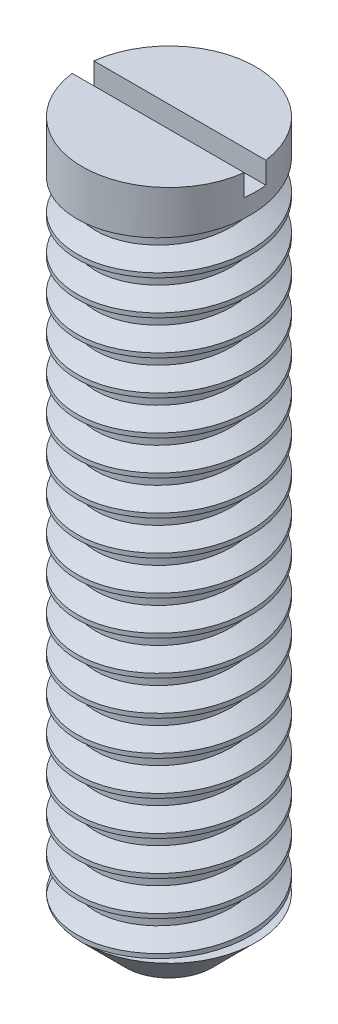
from build123d import *

# Parameters (mm, degrees)
SKETCH1_R           = 2
BOSS_EXTRUDE1_DEPTH = 15
THREAD1_PITCH       = 0.8
BOSS_EXTRUDE2_DEPTH = 0.5
SKETCH5_R           = 2
BOSS_EXTRUDE3_DEPTH = 1
BOSS_EXTRUDE3_TAPER = 45


with BuildPart() as part:
    # Sketch1 → Boss-Extrude1 (new body)
    with BuildSketch(Plane(origin=(0, 0, 0), x_dir=(1, 0, 0), z_dir=(0, 1, 0))):
        with Locations(Location((0, 0, 0), (0, 0, 270))):
            Circle(SKETCH1_R)
    extrude(amount=BOSS_EXTRUDE1_DEPTH)

    # Thread1: the profile of Thread Profile1 profile screwed along a right-hand helix of 18.75 turns, 8 arcs to a turn; built about Z, then put on its axis
    thread1_z = Axis((0, 0, 0), (0, 0, 1))
    thread1_corners = [(2.0003, 0, -0.000173205), (2.0003, 0, 0.700173203), (1.5669873, 0, 0.449999999), (1.5669873, 0, 0.249999999)]
    with BuildLine(mode=Mode.PRIVATE) as thread1_profile:
        Line(thread1_corners[0], thread1_corners[1])
        Line(thread1_corners[1], thread1_corners[2])
        Line(thread1_corners[2], thread1_corners[3])
        Line(thread1_corners[3], thread1_corners[0])
    thread1_cap = Face(thread1_profile.wire())
    thread1_turn_angles = [0, 22.5, 45, 67.5, 90, 112.5, 135, 157.5, 180, 202.5, 225, 247.5, 270, 292.5, 315, 337.5, 360]
    thread1_turn_weights = [1, 0.9238795325112867, 1, 0.9238795325112867, 1, 0.9238795325112867, 1, 0.9238795325112867, 1, 0.9238795325112867, 1, 0.9238795325112867, 1, 0.9238795325112867, 1, 0.9238795325112867, 1]
    thread1_turn_rails = [Edge.make_bspline([Vector(p[0], p[1], 0).rotate(thread1_z, thread1_turn_angles[k]) / thread1_turn_weights[k] + Vector(0, 0, p[2] + THREAD1_PITCH * thread1_turn_angles[k] / 360) for k in range(17)], [0, 0, 0, 1, 1, 2, 2, 3, 3, 4, 4, 5, 5, 6, 6, 7, 7, 8, 8, 8], 2, thread1_turn_weights) for p in thread1_corners]
    thread1_turn_sides = [Face.make_surface_from_curves(thread1_turn_rails[p[0]], thread1_turn_rails[p[1]]) for p in [(0, 1), (1, 2), (2, 3), (3, 0)]]
    thread1_last_angles = [6480, 6502.5, 6525, 6547.5, 6570, 6592.5, 6615, 6637.5, 6660, 6682.5, 6705, 6727.5, 6750]
    thread1_last_weights = [1, 0.9238795325112867, 1, 0.9238795325112867, 1, 0.9238795325112867, 1, 0.9238795325112867, 1, 0.9238795325112867, 1, 0.9238795325112867, 1]
    thread1_last_rails = [Edge.make_bspline([Vector(p[0], p[1], 0).rotate(thread1_z, thread1_last_angles[k]) / thread1_last_weights[k] + Vector(0, 0, p[2] + THREAD1_PITCH * thread1_last_angles[k] / 360) for k in range(13)], [0, 0, 0, 1, 1, 2, 2, 3, 3, 4, 4, 5, 5, 6, 6, 6], 2, thread1_last_weights) for p in thread1_corners]
    thread1_last_sides = [Face.make_surface_from_curves(thread1_last_rails[p[0]], thread1_last_rails[p[1]]) for p in [(0, 1), (1, 2), (2, 3), (3, 0)]]
    thread1 = Plane(origin=(0, 15, 0), x_dir=(-1, 0, 0), z_dir=(0, -1, 0)) * Solid(Shell([*[p.moved(Location((0, 0, THREAD1_PITCH * i))) for i in range(18) for p in thread1_turn_sides], *thread1_last_sides, thread1_cap, thread1_cap.rotate(thread1_z, 6750).moved(Location((0, 0, THREAD1_PITCH * 6750 / 360)))]))
    add(thread1, mode=Mode.SUBTRACT)

    # Sketch4 → Boss-Extrude2 (add)
    with BuildSketch(Plane(origin=(0, 15, 0), x_dir=(1, 0, 0), z_dir=(0, 1, 0))):
        with BuildLine():
            ThreePointArc((1.984313483, 0.25), (0, 2), (-1.984313483, 0.25))
            Line((-1.984313483, 0.25), (1.984313483, 0.25))
        make_face()
        with BuildLine():
            Line((1.984313483, -0.25), (-1.984313483, -0.25))
            ThreePointArc((-1.984313483, -0.25), (0, -2), (1.984313483, -0.25))
        make_face()
    extrude(amount=BOSS_EXTRUDE2_DEPTH)

    # Sketch5 → Boss-Extrude3 (add)
    with BuildSketch(Plane.XZ):
        Circle(SKETCH5_R)
    extrude(amount=BOSS_EXTRUDE3_DEPTH, taper=BOSS_EXTRUDE3_TAPER)


solid = part.part
